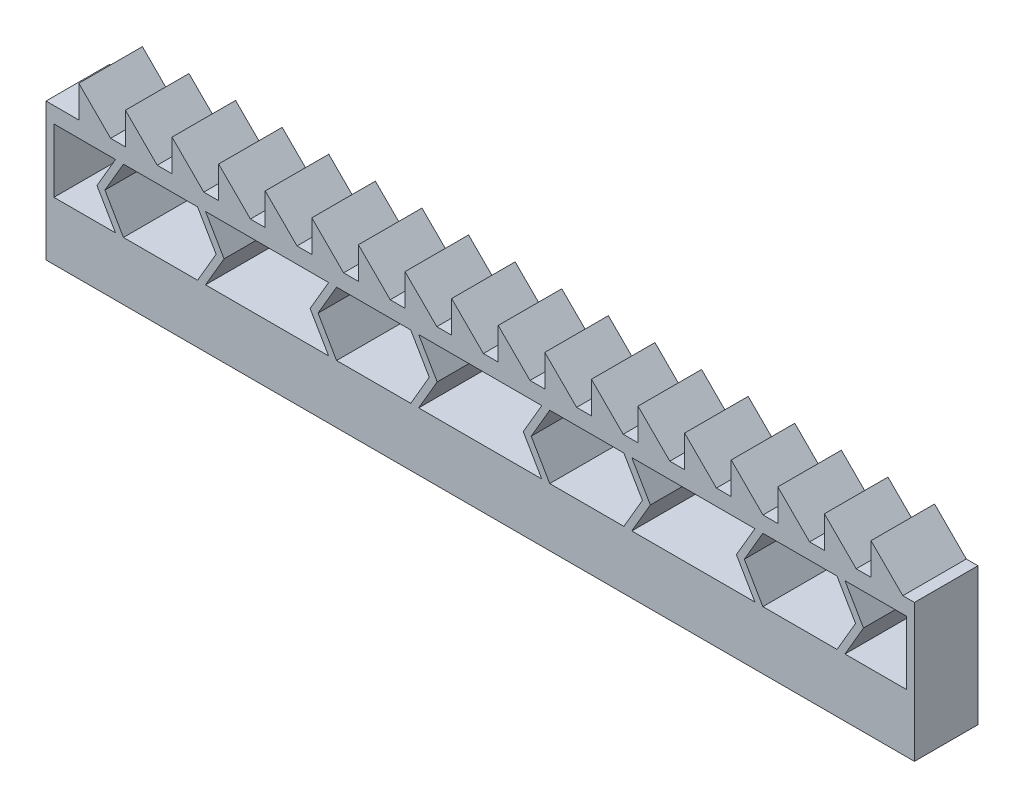
from build123d import *

# Parameters (mm, degrees)
SKETCH1_W           = 82
SKETCH1_H           = 6
BOSS_EXTRUDE1_DEPTH = 13
CUT_EXTRUDE1_DEPTH  = 84.240615087
SKETCH4_W           = 1.4
SKETCH4_H           = 4.8
BOSS_EXTRUDE2_DEPTH = 1.9
SKETCH5_W           = 2.9
SKETCH5_H           = 2
BOSS_EXTRUDE3_DEPTH = 2.1
BOSS_EXTRUDE5_DEPTH = 6
LPATTERN2_COUNT     = 18
LPATTERN2_PITCH     = 4.4
CUT_EXTRUDE2_DEPTH  = 6
LPATTERN3_COUNT     = 4
LPATTERN3_PITCH     = 20.125
FILLET1_R           = 0.5


with BuildPart() as part:
    # Sketch1 → Boss-Extrude1 (new body)
    with BuildSketch(Plane(origin=(0, 0, 0), x_dir=(1, 0, 0), z_dir=(0, 1, 0))):
        with Locations((41, 3)):
            Rectangle(SKETCH1_W, SKETCH1_H)
    extrude(amount=BOSS_EXTRUDE1_DEPTH)

    # Sketch3 → Cut-Extrude1 (cut, through all)
    with BuildSketch(Plane.ZY):
        Polygon((-4, 0), (-2, 0), (-2, 1.8), (-0.6, 1.8), (-0.6, 3.7), (-5.4, 3.7), (-5.4, 1.8), (-4, 1.8), align=None)
    extrude(amount=-CUT_EXTRUDE1_DEPTH, mode=Mode.SUBTRACT)

    # Sketch4 → Boss-Extrude2 (add)
    with BuildSketch(Plane.XZ.offset(-3.7)):
        with Locations((0.7, -3)):
            Rectangle(SKETCH4_W, SKETCH4_H)
        with Locations((81.3, -3)):
            Rectangle(SKETCH4_W, SKETCH4_H)
    extrude(amount=BOSS_EXTRUDE2_DEPTH)

    # Sketch5 → Boss-Extrude3 (add)
    with BuildSketch(Plane.XZ):
        with Locations((80.55, -3)):
            Rectangle(SKETCH5_W, SKETCH5_H)
        with Locations((1.45, -3)):
            Rectangle(SKETCH5_W, SKETCH5_H)
    extrude(amount=-BOSS_EXTRUDE3_DEPTH)

    # Sketch7 → Boss-Extrude5 (add)
    with BuildSketch(Plane.XY):
        Polygon((3.1, 13), (3.1, 16), (6.1, 13), align=None)
    boss_extrude5 = extrude(amount=-BOSS_EXTRUDE5_DEPTH)

    # LPattern2: Boss-Extrude5 ×18
    with Locations(*[(i * LPATTERN2_PITCH, 0, 0) for i in range(1, LPATTERN2_COUNT)]):
        add(boss_extrude5)

    # Sketch6 → Cut-Extrude2 (cut)
    with BuildSketch(Plane.XY):
        Polygon((6.5625, 5.5), (4.8125, 8.5), (6.5625, 11.5), (0.75, 11.5), (0.75, 5.5), align=None)
        Polygon((16.0625, 8.5), (14.3125, 11.5), (7.3125, 11.5), (5.5625, 8.5), (7.3125, 5.5), (14.3125, 5.5), align=None)
        Polygon((20.875, 11.5), (20.875, 5.5), (15.0625, 5.5), (16.8125, 8.5), (15.0625, 11.5), align=None)
    cut_extrude2 = extrude(amount=-CUT_EXTRUDE2_DEPTH, mode=Mode.SUBTRACT)

    # LPattern3: Cut-Extrude2 ×4
    with Locations(*[(i * LPATTERN3_PITCH, 0, 0) for i in range(1, LPATTERN3_COUNT)]):
        add(cut_extrude2, mode=Mode.SUBTRACT)

    # Fillet1
    fillet1_edges = [part.edges().sort_by_distance(p)[0] for p in [
        (79.1, 0, -3),
        (41, 0, -2),
        (41, 0, -4),
        (2.9, 0, -3),
    ]]
    fillet(fillet1_edges, radius=FILLET1_R)


solid = part.part
